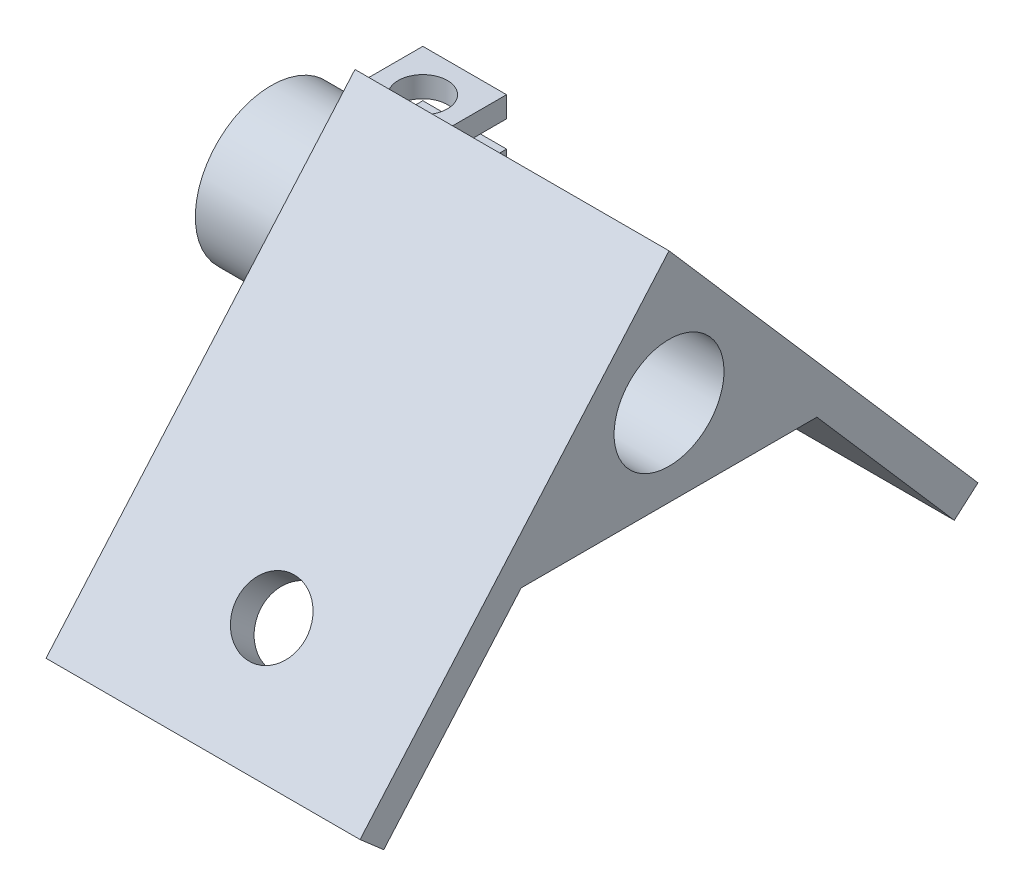
from build123d import *

# Parameters (mm, degrees)
SKETCH1_R            = 5.25
BOSS_EXTRUDE1_DEPTH  = 15
M6_CLEARANCE_HOLE1_D = 6.6
BOSS_EXTRUDE2_START  = 8
BOSS_EXTRUDE2_DEPTH  = 8
SKETCH6_R            = 2.35
CUT_EXTRUDE1_DEPTH   = 46.905147279


with BuildPart() as part:
    # Sketch1 → Boss-Extrude1 (new, symmetric)
    with BuildSketch(Plane(origin=(0, 0, 0), x_dir=(0, 0, -1), z_dir=(1, 0, 0))):
        Polygon((0, 12.575087965), (-29.513243123, -21.376014517), (-27.249114382, -23.344191604), (-14.127933802, -8.25), (14.127933802, -8.25), (27.249114382, -23.344191604), (29.513243123, -21.376014517), align=None)
        Circle(SKETCH1_R, mode=Mode.SUBTRACT)
    extrude(amount=BOSS_EXTRUDE1_DEPTH, both=True)

    # M6 Clearance Hole1 (through all)
    with Locations(Plane(origin=(0, 3.444309902, 3.962225296), x_dir=(-1, 0, 0), z_dir=(0, -0.6560590289905083, -0.7547095802227711))):
        with Locations((0, -25.495112569)):
            m6_clearance_hole1 = Hole(M6_CLEARANCE_HOLE1_D / 2)

    # Mirror1: M6 Clearance Hole1 across plane
    add(m6_clearance_hole1.mirror(Plane.XY), mode=Mode.SUBTRACT)

    # Sketch5 → Boss-Extrude2 (add)
    with BuildSketch(Plane.ZY.offset(15).offset(BOSS_EXTRUDE2_START)):
        with BuildLine():
            Line((-5.099019514, 1.25), (-14.480740698, 1.25))
            Line((-14.480740698, 1.25), (-14.480740698, 3.25))
            Line((-14.480740698, 3.25), (-6.480740698, 3.25))
            ThreePointArc((-6.480740698, 3.25), (7.25, 0), (-6.480740698, -3.25))
            Line((-6.480740698, -3.25), (-6.480740698, -10.25))
            Line((-6.480740698, -10.25), (-14.480740698, -10.25))
            Line((-14.480740698, -10.25), (-14.480740698, -1.25))
            Line((-14.480740698, -1.25), (-5.099019514, -1.25))
            ThreePointArc((-5.099019514, -1.25), (5.25, 0), (-5.099019514, 1.25))
        make_face()
    extrude(amount=-BOSS_EXTRUDE2_DEPTH)

    # Sketch6 → Cut-Extrude1 (cut, through all)
    with BuildSketch(Plane(origin=(0, 3.25, 0), x_dir=(1, 0, 0), z_dir=(0, 1, 0))):
        with Locations((-19, 10.480740698)):
            Circle(SKETCH6_R)
    extrude(amount=-CUT_EXTRUDE1_DEPTH, mode=Mode.SUBTRACT)


solid = part.part
